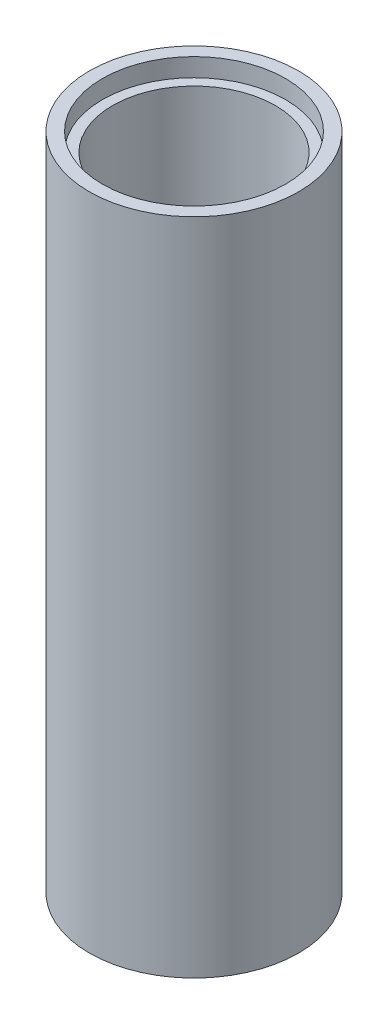
from build123d import *

# Parameters (mm, degrees)
SKETCH1_R           = 57.15
SKETCH1_R_2         = 44.45
BOSS_EXTRUDE1_DEPTH = 360
SKETCH2_R           = 50
CUT_EXTRUDE1_DEPTH  = 10


with BuildPart() as part:
    # Sketch1 → Boss-Extrude1 (new body)
    with BuildSketch(Plane(origin=(0, 0, 0), x_dir=(1, 0, 0), z_dir=(0, 1, 0))):
        Circle(SKETCH1_R)
        Circle(SKETCH1_R_2, mode=Mode.SUBTRACT)
    extrude(amount=BOSS_EXTRUDE1_DEPTH)

    # Sketch2 → Cut-Extrude1 (cut)
    with BuildSketch(Plane(origin=(0, 360, 0), x_dir=(1, 0, 0), z_dir=(0, 1, 0))):
        Circle(SKETCH2_R)
    extrude(amount=-CUT_EXTRUDE1_DEPTH, mode=Mode.SUBTRACT)


solid = part.part
